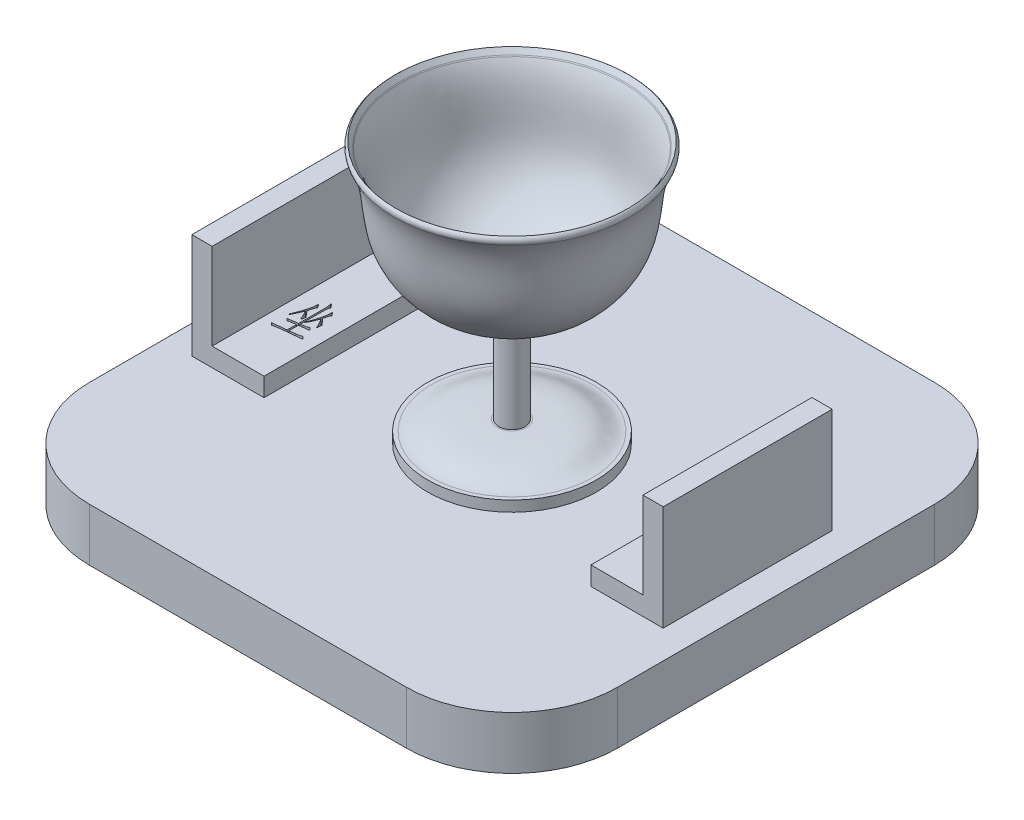
from build123d import *

# Parameters (mm, degrees)
SKETCH_1_W          = 50
SKETCH_1_H          = 50
EXTRUDE_1_DEPTH     = 5
SKETCH_4_R          = 1.25
EXTRUDE_2_DEPTH     = 10
FILLET_1_R          = 10
FILLET_4_R          = 0.5
FILLET_5_R          = 1
SKETCH_11_W         = 1.919055897
SKETCH_11_H         = 9.954073204
SKETCH_11_W_2       = 4.919079957
SKETCH_11_H_2       = 1.768950708
EXTRUDE_3_DEPTH     = 8
CUT_EXTRUDE_2_DEPTH = 1


with BuildPart() as part:
    # 草图1 → 凸台-拉伸1 (new body)
    with BuildSketch(Plane(origin=(0, 0, 0), x_dir=(1, 0, 0), z_dir=(0, 1, 0))):
        Rectangle(SKETCH_1_W, SKETCH_1_H)
    extrude(amount=EXTRUDE_1_DEPTH)

    # 草图3 → 旋转1 (revolve)
    with BuildSketch(Plane(origin=(0, 0, 0), x_dir=(0, 0, -1), z_dir=(1, 0, 0)), mode=Mode.PRIVATE) as revolve_1_sk:
        with BuildLine():
            Line((-8, 5), (-7.234257242, 5))
            add(Edge.make_bspline(
                [(-7.234257242, 5), (-6.301324139, 5.546303871), (-4.626402287, 6.038307603), (-2.732898492, 6), (-2.078286666, 6)],
                knots=[0, 0, 0, 0, 0.595969237, 1, 1, 1, 1], degree=3))
            Line((-2.078286666, 6), (0, 6))
            Line((0, 6), (0, 7))
            Line((0, 7), (-1.391548463, 7))
            add(Edge.make_bspline(
                [(-1.391548463, 7), (-2.433866161, 7), (-3.939958021, 7.013631477), (-6.04492868, 6.649936706), (-7.005174389, 6), (-7.628429692, 6)],
                knots=[0, 0, 0, 0, 0.488086975, 0.710809625, 1, 1, 1, 1], degree=3))
            Line((-7.628429692, 6), (-8, 6))
            Line((-8, 6), (-8, 5))
        make_face()
    revolve(revolve_1_sk.sketch.rotate(Axis((0, 6, 0), (0, 1, 0)), 180), axis=Axis((0, 6, 0), (0, 1, 0)))

    # 草图4 → 凸台-拉伸2 (add)
    with BuildSketch(Plane(origin=(0, 7, 0), x_dir=(1, 0, 0), z_dir=(0, 1, 0))):
        with Locations(Location((0, 0, 0), (0, 0, 90))):
            Circle(SKETCH_4_R)
    extrude(amount=EXTRUDE_2_DEPTH)

    # 草图5 → 旋转2 (revolve)
    with BuildSketch(Plane.XY, mode=Mode.PRIVATE) as revolve_2_sk:
        with BuildLine():
            Line((0, 17), (-1.25, 17))
            add(Edge.make_bspline(
                [(-1.25, 17), (-2.630059385, 17), (-6.135179134, 17.05780237), (-10.910189613, 22.437023501), (-9.773164799, 27.580429816), (-11.594862166, 29.757410703)],
                knots=[0, 0, 0, 0, 0.218481916, 0.565172637, 1, 1, 1, 1], degree=3))
            Line((-11.594862166, 29.757410703), (-10.999404925, 29.757410703))
            Line((-10.999404925, 29.757410703), (-10.639897966, 29.257410703))
            add(Edge.make_bspline(
                [(-1.25, 17.5), (-1.617934887, 17.5), (-2.364033162, 17.503454336), (-3.773764779, 17.588786578), (-5.374160332, 17.959578926), (-7.096535536, 19.137884334), (-8.479375874, 20.835201642), (-9.298423372, 22.777809938), (-9.569103475, 24.88684092), (-9.755738027, 26.734905825), (-10.12641677, 28.191902244), (-10.446374548, 28.919264574), (-10.639897966, 29.257410703)],
                knots=[0, 0, 0, 0, 0.059485551, 0.118971102, 0.237942205, 0.356913307, 0.47588441, 0.594855512, 0.713826615, 0.832797717, 0.892283268, 0.95176882, 0.95176882, 0.95176882, 0.95176882], degree=3))
            Line((-1.25, 17.5), (0, 17.5))
            Line((0, 17.5), (0, 17))
        make_face()
    revolve(revolve_2_sk.sketch.rotate(Axis((0, 17, 0), (0, 1, 0)), 270), axis=Axis((0, 17, 0), (0, 1, 0)))

    # 圆角1
    fillet_1_edges = [part.edges().sort_by_distance(p)[0] for p in [
        (25, 2.5, 25),
        (-25, 2.5, 25),
        (-25, 2.5, -25),
        (25, 2.5, -25),
    ]]
    fillet(fillet_1_edges, radius=FILLET_1_R)

    # 圆角4
    # the kernel refuses this fillet: 0.5 mm, written as the material it takes off along each edge
    with BuildSketch(Plane(origin=(0, 29.757410703, 0), x_dir=(0, 0, -1), z_dir=(1, 0, 0))) as fillet_4_piece_1:
        with BuildLine():
            CenterArc((10.698765824, -0.399519876), FILLET_4_R, 329.051979136, 83.98652381)
            Line((10.999404925, 0), (11.005417707, 0.007990398))
            ThreePointArc((11.005417707, 0.007990398), (11.297133546, 0.01), (11.594862166, 0.01))
            Line((11.594862166, 0.01), (11.602531288, -0.00641752))
            ThreePointArc((11.602531288, -0.00641752), (11.356473351, -0.324945358), (11.136159263, -0.661792595))
            Line((11.136159263, -0.661792595), (11.127582921, -0.656649993))
        make_face()
    revolve(axis=Axis((0, 29.757410703, 0), (0, 1, 0)), mode=Mode.SUBTRACT)

    # 圆角5
    fillet_5_edges = [part.edges().sort_by_distance(p)[0] for p in [
        (0, 29.257410703, 10.639897966),
    ]]
    fillet(fillet_5_edges, radius=FILLET_5_R)

    # 草图11 → 凸台-拉伸3 (add, symmetric)
    with BuildSketch(Plane.XY):
        with Locations((-21.354954929, 9.977036602)):
            Rectangle(SKETCH_11_W, SKETCH_11_H)
        with Locations((-17.935887002, 5.884475354)):
            Rectangle(SKETCH_11_W_2, SKETCH_11_H_2)
    extrude_3 = extrude(amount=EXTRUDE_3_DEPTH, both=True)

    # 镜向1: 凸台-拉伸3 across plane
    add(extrude_3.mirror(Plane(origin=(0, 0, 0), x_dir=(0, 0, 1), z_dir=(1, 0, 0))))

    # 草图12 → 切除-拉伸2 (cut)
    with BuildSketch(Plane(origin=(0, 6.768950708, 0), x_dir=(1, 0, 0), z_dir=(0, 1, 0))):
        with BuildLine():
            Line((-18.180470578, -3.115015444), (-18.170029496, -2.223794476))
            Line((-18.170029496, -2.223794476), (-18.381834312, -2.258846682))
            Line((-18.381834312, -2.258846682), (-18.673438829, -2.309560511))
            Line((-18.673438829, -2.309560511), (-18.809918693, -2.344612716))
            Line((-18.809918693, -2.344612716), (-18.92029585, -2.375190172))
            add(Edge.make_bspline(
                [(-18.92029585, -2.375190172), (-18.922599486, -2.374304337), (-18.928886276, -2.371886829), (-18.938372637, -2.362328031), (-18.951817315, -2.348701684), (-18.96073633, -2.336569831), (-18.965789138, -2.329696884)],
                knots=[0, 0, 0, 0, 0.451492459, 1.232155524, 2.431958457, 4, 4, 4, 4], degree=3))
            Line((-18.965789138, -2.329696884), (-19.071691546, -2.223794476))
            add(Edge.make_bspline(
                [(-19.071691546, -2.223794476), (-19.077064395, -2.217240666), (-19.087098492, -2.205001061), (-19.097621084, -2.184434174), (-19.086952982, -2.167261347), (-19.065447847, -2.159051798), (-19.0326623, -2.153559009), (-19.006353496, -2.150333808), (-18.991146053, -2.148469524)],
                knots=[0, 0, 0, 0, 0.97177075, 1.814836098, 2.262531313, 3.044890217, 4.291839321, 6, 6, 6, 6], degree=3))
            Line((-18.991146053, -2.148469524), (-18.718932117, -2.12311261))
            Line((-18.718932117, -2.12311261), (-18.170029496, -2.047787658))
            Line((-18.170029496, -2.047787658), (-18.155113664, 0.42376572))
            add(Edge.make_bspline(
                [(-18.155113664, 0.42376572), (-18.155358808, 0.42625197), (-18.156339384, 0.43619697), (-18.158400004, 0.454049949), (-18.159761065, 0.483452687), (-18.163183018, 0.524919314), (-18.166617028, 0.584108646), (-18.170987313, 0.655192492), (-18.174317959, 0.727642574), (-18.180251884, 0.789682219), (-18.183532656, 0.836410713), (-18.188269359, 0.861814966), (-18.190165869, 0.871986474)],
                knots=[0, 0, 0, 0, 0.166641306, 0.666565223, 1.198206302, 2.129132125, 3.44168609, 5.152468617, 6.879804781, 8.277472756, 9.310324141, 10, 10, 10, 10], degree=3))
            Line((-18.190165869, 0.871986474), (-18.24610024, 1.073350207))
            Line((-18.24610024, 1.073350207), (-18.200606952, 1.118843495))
            Line((-18.200606952, 1.118843495), (-17.913477184, 0.756388775))
            add(Edge.make_bspline(
                [(-17.913477184, 0.756388775), (-17.925095513, 0.730133434), (-17.946034422, 0.682815253), (-17.969363733, 0.624053041), (-17.980755492, 0.577142916), (-17.988312338, 0.535853104), (-17.993472756, 0.486180693), (-17.999574858, 0.431550128), (-18.003533078, 0.377796929), (-18.006744019, 0.330819207), (-18.008160916, 0.293507412), (-18.008706526, 0.271873196), (-18.008938509, 0.262674733)],
                knots=[0, 0, 0, 0, 1.697249639, 3.0588353, 3.725012415, 4.546115292, 5.537224221, 6.674313859, 7.794100717, 8.721329119, 9.456333157, 10, 10, 10, 10], degree=3))
            Line((-18.008938509, 0.262674733), (-18.019379592, -2.032871826))
            Line((-18.019379592, -2.032871826), (-17.777743112, -1.992599079))
            add(Edge.make_bspline(
                [(-17.777743112, -1.992599079), (-17.736368749, -1.985152485), (-17.653325027, -1.970206205), (-17.529595898, -1.93828237), (-17.406160121, -1.89897777), (-17.324894635, -1.867482389), (-17.28402907, -1.851644466)],
                knots=[0, 0, 0, 0, 0.98026706, 1.967523362, 2.977938722, 4, 4, 4, 4], degree=3))
            Line((-17.28402907, -1.851644466), (-17.113242792, -2.017210202))
            add(Edge.make_bspline(
                [(-17.113242792, -2.017210202), (-17.106167335, -2.026418549), (-17.093540624, -2.042851569), (-17.087608755, -2.071244992), (-17.100578003, -2.096916161), (-17.118226699, -2.097453374), (-17.128158624, -2.097755695)],
                knots=[0, 0, 0, 0, 1.25032074, 2.231295842, 3.004649519, 4, 4, 4, 4], degree=3))
            Line((-17.128158624, -2.097755695), (-17.827711149, -2.178301188))
            Line((-17.827711149, -2.178301188), (-18.019379592, -2.203658103))
            Line((-18.019379592, -2.203658103), (-18.024600133, -3.100099612))
            Line((-18.024600133, -3.100099612), (-17.455561139, -3.03446995))
            add(Edge.make_bspline(
                [(-17.455561139, -3.03446995), (-17.4004926, -3.027288295), (-17.295991784, -3.013660027), (-17.149085194, -2.982338676), (-17.020054124, -2.944123939), (-16.942908895, -2.909693926), (-16.906658518, -2.893515337)],
                knots=[0, 0, 0, 0, 1.170245593, 2.220716597, 3.163918543, 4, 4, 4, 4], degree=3))
            Line((-16.906658518, -2.893515337), (-16.720210617, -3.079963238))
            add(Edge.make_bspline(
                [(-16.720210617, -3.079963238), (-16.71464371, -3.087875101), (-16.704068853, -3.102904422), (-16.69907192, -3.124888844), (-16.701016846, -3.141228113), (-16.709297838, -3.149638016), (-16.721115984, -3.155001788), (-16.730573164, -3.155185341), (-16.73587224, -3.15528819)],
                knots=[0, 0, 0, 0, 1.657312078, 3.148218791, 3.805218043, 4.383042918, 5.093981737, 6, 6, 6, 6], degree=3))
            Line((-16.73587224, -3.15528819), (-17.656924872, -3.241054225))
            Line((-17.656924872, -3.241054225), (-18.160334205, -3.291022262))
            Line((-18.160334205, -3.291022262), (-18.718932117, -3.356651924))
            Line((-18.718932117, -3.356651924), (-18.910600559, -3.391704129))
            Line((-18.910600559, -3.391704129), (-19.16193233, -3.437197417))
            Line((-19.16193233, -3.437197417), (-19.308107484, -3.477470164))
            add(Edge.make_bspline(
                [(-19.308107484, -3.477470164), (-19.310392307, -3.476297523), (-19.317395248, -3.472703402), (-19.328652932, -3.461622792), (-19.344310567, -3.444082592), (-19.356347942, -3.430260099), (-19.363296063, -3.422281585)],
                knots=[0, 0, 0, 0, 0.391389477, 1.199601729, 2.383575496, 4, 4, 4, 4], degree=3))
            Line((-19.363296063, -3.422281585), (-19.478893762, -3.301463345))
            add(Edge.make_bspline(
                [(-19.478893762, -3.301463345), (-19.483301855, -3.296048989), (-19.491721133, -3.28570779), (-19.497164904, -3.265648904), (-19.485167997, -3.24400768), (-19.468664865, -3.242162162), (-19.458757389, -3.241054225)],
                knots=[0, 0, 0, 0, 0.964337664, 1.841845451, 2.704375279, 4, 4, 4, 4], degree=3))
            Line((-19.458757389, -3.241054225), (-19.152237039, -3.220917852))
            Line((-19.152237039, -3.220917852), (-18.43702289, -3.144847108))
            Line((-18.43702289, -3.144847108), (-18.180470578, -3.115015444))
        make_face()
        with BuildLine():
            Line((-17.450340598, -0.506982203), (-17.34443819, -0.607664069))
            Line((-17.34443819, -0.607664069), (-17.122938083, -0.839605258))
            Line((-17.122938083, -0.839605258), (-16.957372347, -1.030527909))
            add(Edge.make_bspline(
                [(-16.957372347, -1.030527909), (-16.946353823, -1.04474779), (-16.928182982, -1.068198047), (-16.910193022, -1.104419681), (-16.907949372, -1.14002843), (-16.910446123, -1.163329881), (-16.911879059, -1.176703064)],
                knots=[0, 0, 0, 0, 1.355079377, 2.234685262, 2.986849478, 4, 4, 4, 4], degree=3))
            Line((-16.911879059, -1.176703064), (-16.937235974, -1.413119002))
            add(Edge.make_bspline(
                [(-16.937235974, -1.413119002), (-16.939133378, -1.425059456), (-16.94251553, -1.446343504), (-16.948193988, -1.47466121), (-16.957605608, -1.494499887), (-16.968142113, -1.50635642), (-16.980549434, -1.511177422), (-16.990950073, -1.503940755), (-16.997603727, -1.490880241), (-17.000411167, -1.480093309), (-17.002119843, -1.473528122)],
                knots=[0, 0, 0, 0, 1.864829648, 3.324088436, 4.438066581, 5.196803732, 5.754780667, 6.287167089, 6.957528535, 8, 8, 8, 8], degree=3))
            Line((-17.002119843, -1.473528122), (-17.027476758, -1.413119002))
            add(Edge.make_bspline(
                [(-17.027476758, -1.413119002), (-17.029789869, -1.408678995), (-17.035347856, -1.398010461), (-17.042893698, -1.377982188), (-17.055731793, -1.353115009), (-17.063466791, -1.333653607), (-17.067749504, -1.322878218)],
                knots=[0, 0, 0, 0, 0.60731619, 1.459270899, 2.593249072, 4, 4, 4, 4], degree=3))
            Line((-17.067749504, -1.322878218), (-17.15873608, -1.126735026))
            add(Edge.make_bspline(
                [(-17.15873608, -1.126735026), (-17.178063779, -1.090759187), (-17.219772278, -1.013124586), (-17.293809404, -0.892327918), (-17.379112371, -0.756357146), (-17.442350226, -0.662420384), (-17.475697512, -0.612884611)],
                knots=[0, 0, 0, 0, 0.811182969, 1.750504467, 2.813771092, 4, 4, 4, 4], degree=3))
            add(Edge.make_bspline(
                [(-17.475697512, -0.612884611), (-17.494144515, -0.670464325), (-17.530206703, -0.783027353), (-17.590705234, -0.945806604), (-17.651716967, -1.100613628), (-17.707235559, -1.221987892), (-17.750574097, -1.312840543), (-17.780638949, -1.373761367), (-17.807118949, -1.429380372), (-17.832475698, -1.47811371), (-17.855113954, -1.520727824), (-17.874124176, -1.557761486), (-17.892159726, -1.587996513), (-17.903274883, -1.606285639), (-17.908256643, -1.614482735)],
                knots=[0, 0, 0, 0, 1.9907739, 3.891779271, 5.717508854, 7.468879255, 8.2854278, 9.032320698, 9.705996221, 10.313776912, 10.841084488, 11.295189235, 11.684107262, 12, 12, 12, 12], degree=3))
            Line((-17.908256643, -1.614482735), (-17.948529389, -1.685332938))
            Line((-17.948529389, -1.685332938), (-17.988802136, -1.624923818))
            Line((-17.988802136, -1.624923818), (-17.968665763, -1.574209989))
            add(Edge.make_bspline(
                [(-17.968665763, -1.574209989), (-17.943810919, -1.522475933), (-17.892841105, -1.416384937), (-17.824211356, -1.249403396), (-17.759273535, -1.072195924), (-17.70952244, -0.919157377), (-17.672396677, -0.79591078), (-17.645867069, -0.708097293), (-17.623396288, -0.625235103), (-17.601180487, -0.54847098), (-17.582543151, -0.47709741), (-17.567247487, -0.411010213), (-17.552456707, -0.350845193), (-17.538608647, -0.27980539), (-17.523593745, -0.202018745), (-17.50836743, -0.120524968), (-17.49757473, -0.054537125), (-17.486137438, 0.012153493), (-17.477321067, 0.084351651), (-17.468920864, 0.151929725), (-17.465945816, 0.201328947), (-17.461906024, 0.230031923), (-17.461762315, 0.251499766), (-17.461064073, 0.263173862), (-17.46078168, 0.267895274)],
                knots=[0, 0, 0, 0, 1.971680505, 4.043324022, 6.199743635, 8.455168265, 9.571101203, 10.622399692, 11.606786523, 12.520766751, 13.368098878, 14.140856681, 14.851497017, 15.49642256, 16.62716338, 17.573729428, 18.34464401, 18.924585954, 19.898241828, 20.843380901, 21.263306531, 21.598172482, 21.837486912, 22, 22, 22, 22], degree=3))
            Line((-17.46078168, 0.267895274), (-17.480918053, 0.42376572))
            Line((-17.480918053, 0.42376572), (-17.435424765, 0.459563717))
            Line((-17.435424765, 0.459563717), (-17.203483576, 0.132161202))
            add(Edge.make_bspline(
                [(-17.203483576, 0.132161202), (-17.214326941, 0.122377237), (-17.234709063, 0.103986453), (-17.261006055, 0.075820518), (-17.281169264, 0.048688415), (-17.298724889, 0.013627127), (-17.313529736, -0.030807013), (-17.324146336, -0.066197414), (-17.329522358, -0.084118363)],
                knots=[0, 0, 0, 0, 1.02782288, 1.931984298, 2.709170603, 3.397977351, 4.682390842, 6, 6, 6, 6], degree=3))
            Line((-17.329522358, -0.084118363), (-17.380236187, -0.260870973))
            Line((-17.380236187, -0.260870973), (-17.450340598, -0.506982203))
        make_face()
        with BuildLine():
            Line((-18.819613983, -0.60318932), (-18.689100453, -0.744143933))
            Line((-18.689100453, -0.744143933), (-18.517568384, -0.940287125))
            Line((-18.517568384, -0.940287125), (-18.422107058, -1.066325906))
            add(Edge.make_bspline(
                [(-18.422107058, -1.066325906), (-18.407266293, -1.085831096), (-18.381278301, -1.119987064), (-18.34954476, -1.166027633), (-18.329030313, -1.198274272), (-18.320073472, -1.222800345), (-18.322602802, -1.242629404), (-18.323496057, -1.26448888), (-18.326777075, -1.291862003), (-18.329590064, -1.311949523), (-18.331120483, -1.322878218)],
                knots=[0, 0, 0, 0, 2.046142001, 3.583044361, 4.661544621, 5.245923559, 5.702936851, 6.306171552, 7.078465886, 8, 8, 8, 8], degree=3))
            Line((-18.331120483, -1.322878218), (-18.36691848, -1.504105578))
            add(Edge.make_bspline(
                [(-18.36691848, -1.504105578), (-18.37019591, -1.516829146), (-18.375982967, -1.539295533), (-18.385954718, -1.567898973), (-18.396068279, -1.587026918), (-18.407508197, -1.598424777), (-18.421407284, -1.598459831), (-18.432110264, -1.588252605), (-18.440784479, -1.571513211), (-18.445003559, -1.557671088), (-18.447463973, -1.549598866)],
                knots=[0, 0, 0, 0, 1.837882609, 3.245204551, 4.210766595, 4.878318006, 5.364836743, 5.983566732, 6.824089473, 8, 8, 8, 8], degree=3))
            Line((-18.447463973, -1.549598866), (-18.477295637, -1.453391749))
            add(Edge.make_bspline(
                [(-18.477295637, -1.453391749), (-18.481200238, -1.443417169), (-18.491555739, -1.41696331), (-18.513884734, -1.368520234), (-18.545144221, -1.300631898), (-18.576407338, -1.233726757), (-18.604367831, -1.176206192), (-18.622319892, -1.135249717), (-18.639451397, -1.100143927), (-18.652280521, -1.069682536), (-18.663745937, -1.044947198), (-18.672504674, -1.025469848), (-18.679492985, -1.011535695), (-18.68266712, -1.003692873), (-18.683879911, -1.000696245)],
                knots=[0, 0, 0, 0, 0.7747251, 2.054669879, 3.856996971, 6.18186786, 7.396476262, 8.482914576, 9.416119061, 10.221341426, 10.873204414, 11.388155012, 11.766222886, 12, 12, 12, 12], degree=3))
            Line((-18.683879911, -1.000696245), (-18.85988673, -0.708345936))
            add(Edge.make_bspline(
                [(-18.85988673, -0.708345936), (-18.878388048, -0.757871263), (-18.91446638, -0.854447689), (-18.969509903, -0.994489746), (-19.024171686, -1.126179451), (-19.077815604, -1.249662505), (-19.129811247, -1.365491852), (-19.181243206, -1.472938284), (-19.231834014, -1.572108332), (-19.266202579, -1.634942688), (-19.28275057, -1.665196565)],
                knots=[0, 0, 0, 0, 1.211744292, 2.362951217, 3.448626909, 4.479621129, 5.448687622, 6.358520099, 7.209650055, 8, 8, 8, 8], degree=3))
            Line((-19.28275057, -1.665196565), (-19.348380231, -1.775573722))
            Line((-19.348380231, -1.775573722), (-19.398348269, -1.710689852))
            Line((-19.398348269, -1.710689852), (-19.353600772, -1.604787445))
            add(Edge.make_bspline(
                [(-19.353600772, -1.604787445), (-19.308515728, -1.50695848), (-19.219913575, -1.314702779), (-19.121483522, -1.069649437), (-19.049851424, -0.8713491), (-19.000251877, -0.71551454), (-18.953002635, -0.551688092), (-18.917381413, -0.41106144), (-18.890845379, -0.298743588), (-18.872760658, -0.219723034), (-18.857528281, -0.146493106), (-18.842546894, -0.079918613), (-18.832641189, -0.018759088), (-18.823466874, 0.035857173), (-18.816609237, 0.08458546), (-18.810898397, 0.139283466), (-18.807054234, 0.197758197), (-18.803908074, 0.257663244), (-18.802569263, 0.304709642), (-18.804066142, 0.331787478), (-18.804698151, 0.343220226)],
                knots=[0, 0, 0, 0, 2.853370921, 5.607509287, 6.992821882, 8.438274986, 9.939081977, 11.509265292, 12.280829121, 12.996605565, 13.656676567, 14.262472747, 14.803840823, 15.29756437, 15.729732459, 16.107203266, 16.754266667, 17.281797515, 17.696762007, 18, 18, 18, 18], degree=3))
            Line((-18.804698151, 0.343220226), (-18.814393442, 0.443902093))
            Line((-18.814393442, 0.443902093), (-18.769645946, 0.474479549))
            Line((-18.769645946, 0.474479549), (-18.542925298, 0.12172012))
            add(Edge.make_bspline(
                [(-18.542925298, 0.12172012), (-18.555282313, 0.104437717), (-18.578431552, 0.072061411), (-18.608130982, 0.025162431), (-18.631793582, -0.015905939), (-18.64932712, -0.053592649), (-18.662192737, -0.091934514), (-18.675705634, -0.133671747), (-18.689823764, -0.181434821), (-18.705046555, -0.237312552), (-18.724035599, -0.304879867), (-18.750102209, -0.38820114), (-18.781534966, -0.489914756), (-18.806261887, -0.56347052), (-18.819613983, -0.60318932)],
                knots=[0, 0, 0, 0, 0.979369069, 1.834718987, 2.558361139, 3.163564866, 3.747220212, 4.421427214, 5.186629972, 6.04313105, 7.091687928, 8.422301116, 10.068106494, 12, 12, 12, 12], degree=3))
        make_face()
    extrude(amount=-CUT_EXTRUDE_2_DEPTH, mode=Mode.SUBTRACT)


solid = part.part
